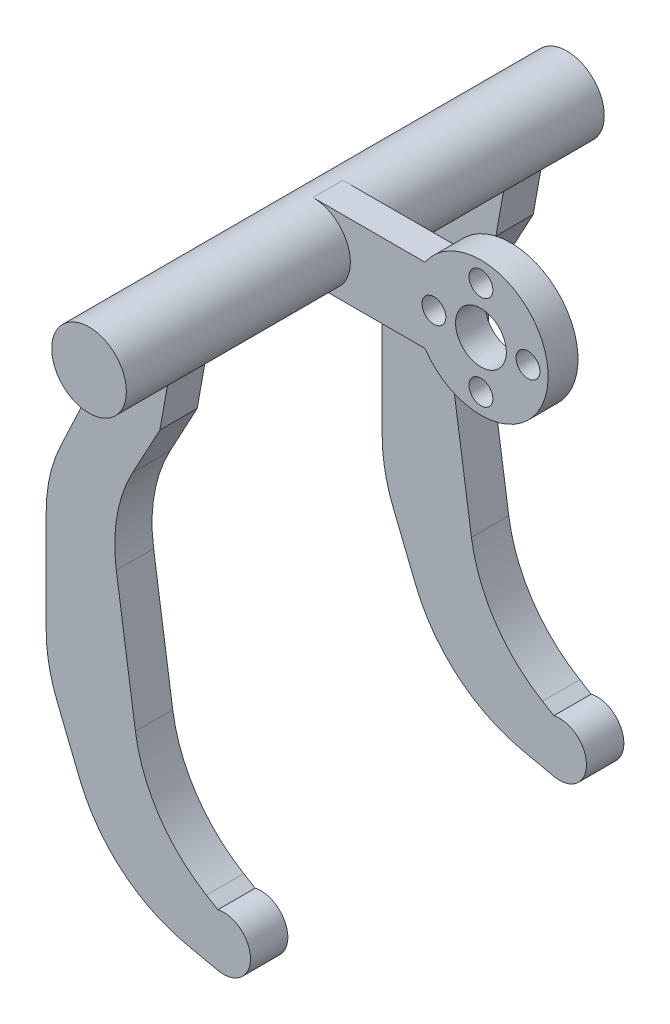
from build123d import *

# Parameters (mm, degrees)
SKETCH2_R                = 11.43
BOSS_EXTRUDE1_DEPTH      = 5.08
SKETCH4_R                = 4.318
SKETCH4_R_2              = 2.032
CUT_EXTRUDE1_DEPTH       = 5.08
BOSS_EXTRUDE2_DEPTH      = 5.08
CIRPATTERN1_COUNT        = 4
BOSS_EXTRUDE3_DEPTH      = 38.1
BOSS_EXTRUDE3_DEPTH_BACK = 43.18
SKETCH9_R                = 6.35
BOSS_EXTRUDE4_DEPTH      = 6.35
FILLET1_R                = 25.4
FILLET1_OF_MIRROR1_R     = 25.4


with BuildPart() as part:
    # Sketch2 → Boss-Extrude1 (new body)
    with BuildSketch(Plane.XY):
        Circle(SKETCH2_R)
    extrude(amount=BOSS_EXTRUDE1_DEPTH)

    # Sketch4 → Cut-Extrude1 (cut)
    with BuildSketch(Plane(origin=(0, 0, 0), x_dir=(-1, 0, 0), z_dir=(0, 0, -1))):
        Circle(SKETCH4_R)
        with Locations((0, -8.001)):
            Circle(SKETCH4_R_2)
    cut_extrude1 = extrude(amount=-CUT_EXTRUDE1_DEPTH, mode=Mode.SUBTRACT)

    # Sketch7 → Boss-Extrude2 (add)
    with BuildSketch(Plane(origin=(0, 0, 0), x_dir=(-1, 0, 0), z_dir=(0, 0, -1))):
        with BuildLine():
            Line((9.503809762, 6.35), (28.553809762, 6.35))
            ThreePointArc((28.553809762, 6.35), (34.903809762, 0), (28.553809762, -6.35))
            Line((28.553809762, -6.35), (9.503809762, -6.35))
            Line((9.503809762, -6.35), (9.503809762, 6.35))
        make_face()
    extrude(amount=-BOSS_EXTRUDE2_DEPTH)

    # CirPattern1: Cut-Extrude1 ×4 about axis
    cirpattern1_axis = Axis((0, 0, 5.08), (0, 0, -1))
    for i in range(1, CIRPATTERN1_COUNT):
        add(cut_extrude1.rotate(cirpattern1_axis, i * 360 / CIRPATTERN1_COUNT), mode=Mode.SUBTRACT)

    # Sketch9 → Boss-Extrude3 (add, two sides: drawn at the far end of the back side and taken through both)
    with BuildSketch(Plane.XY.offset(5.08).offset(-BOSS_EXTRUDE3_DEPTH_BACK)):
        with Locations((-28.553809762, 0)):
            Circle(SKETCH9_R)
    extrude(amount=BOSS_EXTRUDE3_DEPTH + BOSS_EXTRUDE3_DEPTH_BACK)

    # Sketch12 → Boss-Extrude4 (add)
    with BuildSketch(Plane.XY.offset(-31.75)):
        with BuildLine():
            Line((-25.378809762, 0), (-33.047894508, 0))
            Line((-33.047894508, 0), (-47.267412368, -30.245447294))
            Line((-47.267412368, -30.245447294), (-47.267412368, -58.33420365))
            Line((-47.267412368, -58.33420365), (-36.57534741, -84.867934272))
            Line((-36.57534741, -84.867934272), (-18.073665796, -88.9))
            ThreePointArc((-18.073665796, -88.9), (-12.52460446, -84.430000607), (-18.073665796, -79.960001215))
            Line((-18.073665796, -79.960001215), (-30.345802798, -72.608060715))
            Line((-30.345802798, -72.608060715), (-36.57534741, -30.245447294))
            Line((-36.57534741, -30.245447294), (-27.94, -14.249719927))
            Line((-27.94, -14.249719927), (-25.378809762, 0))
        make_face()
    boss_extrude4 = extrude(amount=BOSS_EXTRUDE4_DEPTH)

    # Fillet1
    fillet1_edges = [part.edges().sort_by_distance(p)[0] for p in [
        (-36.57534741, -30.245447294, -28.575),
        (-30.345802798, -72.608060715, -28.575),
        (-36.57534741, -84.867934272, -28.575),
        (-47.267412368, -58.33420365, -28.575),
        (-47.267412368, -30.245447294, -28.575),
    ]]
    fillet(fillet1_edges, radius=FILLET1_R)

    # Mirror1: Boss-Extrude4 across plane
    add(boss_extrude4.mirror(Plane.XY))

    # Fillet1 of Mirror1
    fillet1_of_mirror1_edges = [part.edges().sort_by_distance(p)[0] for p in [
        (-36.57534741, -30.245447294, 28.575),
        (-30.345802798, -72.608060715, 28.575),
        (-36.57534741, -84.867934272, 28.575),
        (-47.267412368, -58.33420365, 28.575),
        (-47.267412368, -30.245447294, 28.575),
    ]]
    fillet(fillet1_of_mirror1_edges, radius=FILLET1_OF_MIRROR1_R)


solid = part.part
